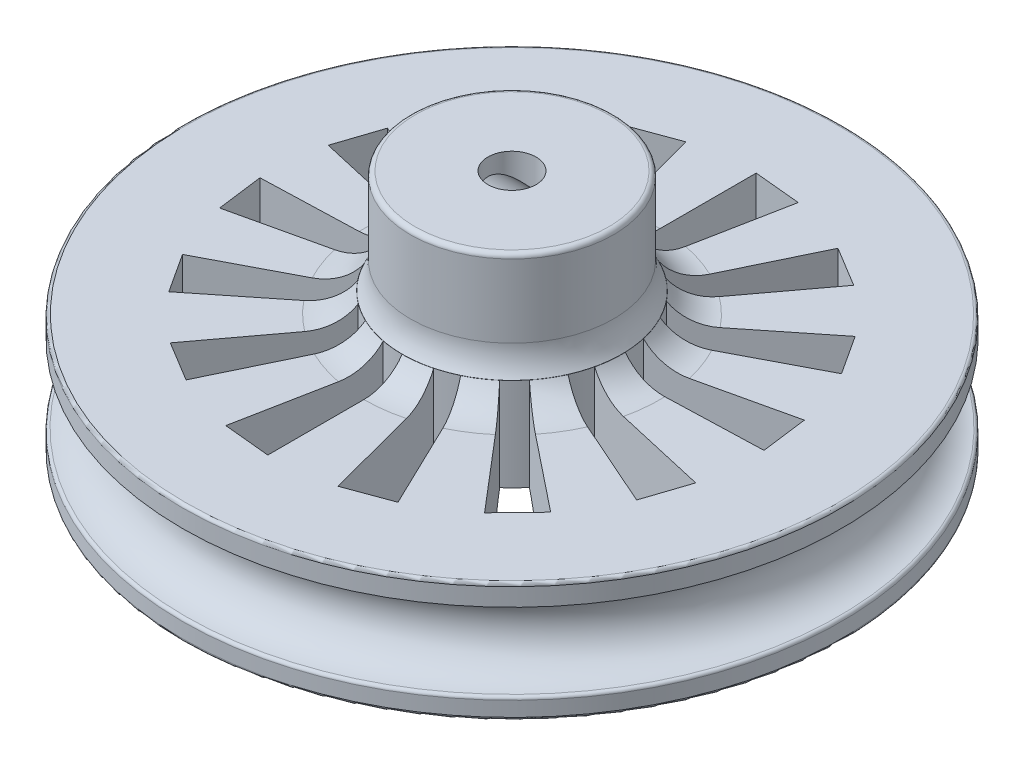
from build123d import *

# Parameters (mm, degrees)
SKETCH1_R           = 19.6
BOSS_EXTRUDE1_DEPTH = 7.7
SKETCH2_R           = 2.981331408
SKETCH4_R           = 6.55
BOSS_EXTRUDE3_DEPTH = 6
SKETCH7_R           = 1.55
CUT_EXTRUDE3_DEPTH  = 10
SKETCH10_R          = 21.25
BOSS_EXTRUDE4_DEPTH = 7.7
SKETCH11_R          = 2.5
FILLET6_R           = 0.2
SKETCH12_R          = 1.55
CUT_EXTRUDE6_DEPTH  = 6.5
SKETCH13_R          = 6.55
SKETCH13_R_2        = 1.55
BOSS_EXTRUDE5_DEPTH = 2
SKETCH8_R           = 1.9
CUT_EXTRUDE4_DEPTH  = 10
FILLET7_R           = 3
FILLET8_R           = 0.3
SKETCH14_R          = 10
CUT_EXTRUDE10_DEPTH = 3
FILLET14_R          = 7
FILLET15_R          = 7
CUT_EXTRUDE11_START = -6
CUT_EXTRUDE11_DEPTH = 18
BOSS_EXTRUDE6_REACH = 34.625
SKETCH17_R          = 7.084308609
CIRPATTERN4_COUNT   = 14
SKETCH18_R          = 7.084308609
BOSS_EXTRUDE7_DEPTH = 6
SKETCH19_R          = 1.55
CUT_EXTRUDE12_DEPTH = 32.370766811


with BuildPart() as part:
    # Sketch1 → Boss-Extrude1 (new body)
    with BuildSketch(Plane(origin=(0, 0, 0), x_dir=(1, 0, 0), z_dir=(0, 1, 0))):
        with Locations(Location((0, 0, 0), (0, 0, 90))):
            Circle(SKETCH1_R)
    extrude(amount=BOSS_EXTRUDE1_DEPTH)

    # Sketch2 → Cut-Revolve1 (revolve, cut)
    with BuildSketch(Plane(origin=(0, 0, 0), x_dir=(0, 0, -1), z_dir=(1, 0, 0)), mode=Mode.PRIVATE) as cut_revolve1_sk:
        with Locations((-19.6, 3.85)):
            Circle(SKETCH2_R)
    revolve(cut_revolve1_sk.sketch.rotate(Axis((0, 11.934736765, 0), (0, -1, 0)), 180), axis=Axis((0, 11.934736765, 0), (0, -1, 0)), mode=Mode.SUBTRACT)

    # Sketch4 → Boss-Extrude3 (add)
    with BuildSketch(Plane(origin=(0, 7.7, 0), x_dir=(1, 0, 0), z_dir=(0, 1, 0))):
        with Locations(Location((0, 0, 0), (0, 0, 270))):
            Circle(SKETCH4_R)
    extrude(amount=BOSS_EXTRUDE3_DEPTH)

    # Sketch7 → Cut-Extrude3 (cut)
    with BuildSketch(Plane(origin=(0, 13.7, 0), x_dir=(1, 0, 0), z_dir=(0, 1, 0))):
        with Locations(Location((0, 0, 0), (0, 0, 270))):
            Circle(SKETCH7_R)
    extrude(amount=-CUT_EXTRUDE3_DEPTH, mode=Mode.SUBTRACT)

    # Sketch10 → Boss-Extrude4 (add)
    with BuildSketch(Plane(origin=(0, 0, 0), x_dir=(-1, 0, 0), z_dir=(0, -1, 0))):
        with Locations(Location((0, 0, 0), (0, 0, 90))):
            Circle(SKETCH10_R)
    extrude(amount=-BOSS_EXTRUDE4_DEPTH)

    # Sketch11 → Cut-Revolve2 (revolve, cut)
    with BuildSketch(Plane(origin=(0, 0, 0), x_dir=(0, 0, -1), z_dir=(1, 0, 0))):
        with Locations((21.25, 3.85)):
            Circle(SKETCH11_R)
    revolve(axis=Axis((0, 0, 0), (0, 1, 0)), mode=Mode.SUBTRACT)

    # Fillet6
    fillet6_edges = [part.edges().sort_by_distance(p)[0] for p in [
        (0, 0, 21.25),
        (0, 7.7, 21.25),
        (0, 1.35, 21.25),
    ]]
    fillet(fillet6_edges, radius=FILLET6_R)

    # Sketch12 → Cut-Extrude6 (cut)
    with BuildSketch(Plane(origin=(0, 7.7, 0), x_dir=(1, 0, 0), z_dir=(0, 1, 0))):
        with Locations(Location((0, 0, 0), (0, 0, 270))):
            Circle(SKETCH12_R)
    extrude(amount=-CUT_EXTRUDE6_DEPTH, mode=Mode.SUBTRACT)

    # Sketch13 → Boss-Extrude5 (add)
    with BuildSketch(Plane(origin=(0, 13.7, 0), x_dir=(1, 0, 0), z_dir=(0, 1, 0))):
        with Locations(Location((0, 0, 0), (0, 0, 270))):
            Circle(SKETCH13_R)
        with Locations(Location((0, 0, 0), (0, 0, 270))):
            Circle(SKETCH13_R_2, mode=Mode.SUBTRACT)
    extrude(amount=BOSS_EXTRUDE5_DEPTH)

    # Sketch8 → Cut-Extrude4 (cut)
    with BuildSketch(Plane(origin=(0, 0, 0), x_dir=(0, 0, -1), z_dir=(1, 0, 0))):
        with Locations((0, 12.7)):
            Circle(SKETCH8_R)
    extrude(amount=-CUT_EXTRUDE4_DEPTH, mode=Mode.SUBTRACT)

    # Fillet7
    fillet7_edges = [part.edges().sort_by_distance(p)[0] for p in [
        (0, 7.7, -6.55),
    ]]
    fillet(fillet7_edges, radius=FILLET7_R)

    # Fillet8
    fillet8_edges = [part.edges().sort_by_distance(p)[0] for p in [
        (0, 15.7, -6.55),
    ]]
    fillet(fillet8_edges, radius=FILLET8_R)

    # Sketch14 → Cut-Extrude10 (cut)
    with BuildSketch(Plane.XZ):
        with Locations(Location((0, 0, 0), (0, 0, 270))):
            Circle(SKETCH14_R)
    extrude(amount=-CUT_EXTRUDE10_DEPTH, mode=Mode.SUBTRACT)

    # Fillet14
    # the kernel refuses this fillet: 7 mm, written as the material it takes off along each edge
    with BuildSketch(Plane(origin=(0, 0, 0), x_dir=(0, 0, -1), z_dir=(-1, 0, 0))) as fillet14_piece_1:
        with BuildLine():
            CenterArc((15.744562647, -7), FILLET14_R, 90, 55.150095421)
            Line((15.744562647, 0), (15.744562647, 0.14))
            Line((15.744562647, 0.14), (10, 0.14))
            Line((10, 0.14), (9.86, 0))
            ThreePointArc((9.86, 0), (9.86, -1.5), (9.885108747, -2.92))
            Line((9.885108747, -2.92), (10, -3))
        make_face()
    revolve(axis=Axis((0, 0, 0), (0, -1, 0)), mode=Mode.SUBTRACT)

    # Fillet15
    fillet15_edges = [part.edges().sort_by_distance(p)[0] for p in [
        (0, 3, 10),
    ]]
    fillet(fillet15_edges, radius=FILLET15_R)

    # Sketch16 → Cut-Extrude11 (cut)
    with BuildSketch(Plane.XZ.offset(-3).offset(CUT_EXTRUDE11_START)):
        with BuildLine():
            ThreePointArc((-0.666896899, 3.435876675), (-0.334986296, 3.483932287), (0, 3.5))
            Line((0, 3.5), (0, 15.744562647))
            Line((0, 15.744562647), (-3, 15.456107302))
            Line((-3, 15.456107302), (-0.666896899, 3.435876675))
        make_face()
    cut_extrude11 = extrude(amount=CUT_EXTRUDE11_DEPTH, mode=Mode.SUBTRACT)

    # Boss-Extrude6: up to this face of the body (flat: up to its plane)
    boss_extrude6_end = Plane(part.part.faces().sort_by_distance((-0.52472239, 9, 5.457230037))[0])
    # Sketch17 → Boss-Extrude6 (add, up to the picked face)
    with BuildSketch(Plane(origin=(0, 3, 0), x_dir=(-1, 0, 0), z_dir=(0, -1, 0)), mode=Mode.PRIVATE) as boss_extrude6_sk1:
        with Locations(Location((0, 0, 0), (0, 0, 90))):
            Circle(SKETCH17_R)
    boss_extrude6_tool1 = split(extrude(boss_extrude6_sk1.sketch, amount=-BOSS_EXTRUDE6_REACH, mode=Mode.PRIVATE), bisect_by=boss_extrude6_end, keep=Keep.BOTH, mode=Mode.PRIVATE)
    add(boss_extrude6_tool1.solids().sort_by(Axis((0, 3, 0), (0, 1, 0)))[0])

    # CirPattern4: Cut-Extrude11 ×14 about axis
    cirpattern4_axis = Axis((0, 0, 0), (0, 1, 0))
    for i in range(1, CIRPATTERN4_COUNT):
        add(cut_extrude11.rotate(cirpattern4_axis, i * 360 / CIRPATTERN4_COUNT), mode=Mode.SUBTRACT)

    # Sketch18 → Boss-Extrude7 (add)
    with BuildSketch(Plane(origin=(0, 3, 0), x_dir=(-1, 0, 0), z_dir=(0, -1, 0))):
        with Locations(Location((0, 0, 0), (0, 0, 90))):
            Circle(SKETCH18_R)
    extrude(amount=-BOSS_EXTRUDE7_DEPTH)

    # Sketch19 → Cut-Extrude12 (cut, through all)
    with BuildSketch(Plane(origin=(0, 9, 0), x_dir=(1, 0, 0), z_dir=(0, 1, 0))):
        with Locations(Location((0, 0, 0), (0, 0, 270))):
            Circle(SKETCH19_R)
    extrude(amount=-CUT_EXTRUDE12_DEPTH, mode=Mode.SUBTRACT)


solid = part.part
